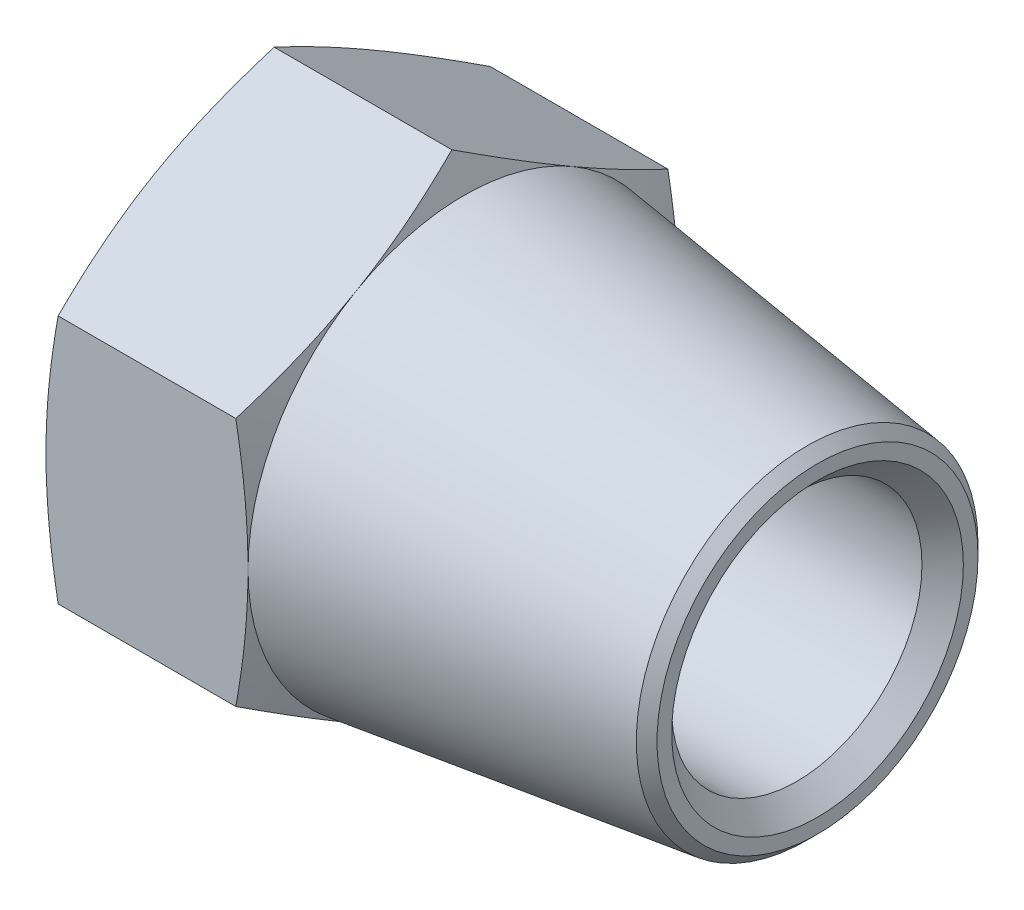
from build123d import *

# Parameters (mm, degrees)
SKETCH1_W          = 9.525
SKETCH1_H          = 9.525
CUT_SWEEP1_PITCH   = 1.5875
EXTRUDE1_DEPTH     = 10.390909091
SKETCH10_OUTSIDE_W = 146.182
SKETCH10_OUTSIDE_H = 149.622
SKETCH10_OUTSIDE_R = 11.1125
CUT_EXTRUDE2_DEPTH = 20.902483672
CUT_EXTRUDE2_DRAFT = -70
SKETCH11_OUTSIDE_W = 146.182
SKETCH11_OUTSIDE_H = 149.622
SKETCH11_OUTSIDE_R = 11.1125
CUT_EXTRUDE3_DEPTH = 20.902483724
CUT_EXTRUDE3_DRAFT = -70


with BuildPart() as part:
    # Sketch1 → Revolve1 (revolve)
    with BuildSketch(Plane.XY, mode=Mode.PRIVATE) as revolve1_sk:
        with Locations((4.7625, 4.7625)):
            Rectangle(SKETCH1_W, SKETCH1_H)
    revolve(revolve1_sk.sketch.rotate(Axis((0, 0, 0), (-1, 0, 0)), 90), axis=Axis((0, 0, 0), (-1, 0, 0)))

    # Cut-Sweep1: the profile of Sketch13 profile screwed along a right-hand helix of 7 turns, 8 arcs to a turn; built about Z, then put on its axis
    cut_sweep1_z = Axis((0, 0, 0), (0, 0, 1))
    cut_sweep1_corners = [(9.5253, 0, -1.389235705), (9.5253, 0, 0.000173205), (8.493888504, 0, -0.5953125), (8.493888504, 0, -0.79375)]
    with BuildLine(mode=Mode.PRIVATE) as cut_sweep1_profile:
        Line(cut_sweep1_corners[0], cut_sweep1_corners[1])
        Line(cut_sweep1_corners[1], cut_sweep1_corners[2])
        Line(cut_sweep1_corners[2], cut_sweep1_corners[3])
        Line(cut_sweep1_corners[3], cut_sweep1_corners[0])
    cut_sweep1_cap = Face(cut_sweep1_profile.wire())
    cut_sweep1_turn_angles = [0, 22.5, 45, 67.5, 90, 112.5, 135, 157.5, 180, 202.5, 225, 247.5, 270, 292.5, 315, 337.5, 360]
    cut_sweep1_turn_weights = [1, 0.9238795325112867, 1, 0.9238795325112867, 1, 0.9238795325112867, 1, 0.9238795325112867, 1, 0.9238795325112867, 1, 0.9238795325112867, 1, 0.9238795325112867, 1, 0.9238795325112867, 1]
    cut_sweep1_turn_rails = [Edge.make_bspline([Vector(p[0], p[1], 0).rotate(cut_sweep1_z, cut_sweep1_turn_angles[k]) / cut_sweep1_turn_weights[k] + Vector(0, 0, p[2] + CUT_SWEEP1_PITCH * cut_sweep1_turn_angles[k] / 360) for k in range(17)], [0, 0, 0, 1, 1, 2, 2, 3, 3, 4, 4, 5, 5, 6, 6, 7, 7, 8, 8, 8], 2, cut_sweep1_turn_weights) for p in cut_sweep1_corners]
    cut_sweep1_turn_sides = [Face.make_surface_from_curves(cut_sweep1_turn_rails[p[0]], cut_sweep1_turn_rails[p[1]]) for p in [(0, 1), (1, 2), (2, 3), (3, 0)]]
    cut_sweep1 = Plane(origin=(0, 0, 0), x_dir=(0, 1, 0), z_dir=(1, 0, 0)) * Solid(Shell([*[p.moved(Location((0, 0, CUT_SWEEP1_PITCH * i))) for i in range(7) for p in cut_sweep1_turn_sides], cut_sweep1_cap, cut_sweep1_cap.rotate(cut_sweep1_z, 2520).moved(Location((0, 0, CUT_SWEEP1_PITCH * 2520 / 360)))]))
    add(cut_sweep1, mode=Mode.SUBTRACT)


with BuildPart() as body_2:
    # Sketch4 → Extrude1 (new body)
    with BuildSketch(Plane.ZY):
        Polygon((0, 12.831609733), (-11.1125, 6.415804866), (-11.1125, -6.415804866), (0, -12.831609733), (11.1125, -6.415804866), (11.1125, 6.415804866), align=None)
    extrude(amount=-EXTRUDE1_DEPTH)

    # Combine1: cut part
    add(part.part, mode=Mode.SUBTRACT)

    # Cut-Extrude1 cone 1 section (through the dimple's axis) → Cut-Extrude1 (revolve, cut)
    with BuildSketch(Plane.ZX):
        Polygon((0, 0), (9.525, 0), (0, 9.525), align=None)
    revolve(axis=Axis((0, 0, 0), (1, 0, 0)), mode=Mode.SUBTRACT)


with BuildPart() as cut_extrude2_tool:
    # Sketch10 outside → Cut-Extrude2 (with draft: the straight prism first)
    with BuildSketch(Plane.ZY):
        Rectangle(SKETCH10_OUTSIDE_W, SKETCH10_OUTSIDE_H)
        Circle(SKETCH10_OUTSIDE_R, mode=Mode.SUBTRACT)
    extrude(amount=-CUT_EXTRUDE2_DEPTH)
    # Cut-Extrude2: the draft: its side faces are tilted about the plane it starts from
    cut_extrude2_sides = [cut_extrude2_tool.faces().sort_by_distance(p)[0] for p in [
        (10.451241836, -74.811, 0),
        (10.451241836, 0, 73.091),
        (10.451241836, 74.811, 0),
        (10.451241836, 0, -73.091),
        (10.451241836, 0, -11.1125),
    ]]
    draft(cut_extrude2_sides, Plane.ZY, CUT_EXTRUDE2_DRAFT)


with BuildPart() as body_2_1:
    add(body_2.part)

    # Cut-Extrude2: cut by cut_extrude2_tool
    add(cut_extrude2_tool.part, mode=Mode.SUBTRACT)


with BuildPart() as cut_extrude3_tool:
    # Sketch11 outside → Cut-Extrude3 (with draft: the straight prism first)
    with BuildSketch(Plane(origin=(10.390909091, 0, 0), x_dir=(0, 0, -1), z_dir=(1, 0, 0))):
        Rectangle(SKETCH11_OUTSIDE_W, SKETCH11_OUTSIDE_H)
        Circle(SKETCH11_OUTSIDE_R, mode=Mode.SUBTRACT)
    extrude(amount=-CUT_EXTRUDE3_DEPTH)
    # Cut-Extrude3: the draft: its side faces are tilted about the plane it starts from
    cut_extrude3_sides = [cut_extrude3_tool.faces().sort_by_distance(p)[0] for p in [
        (-0.060332771, -74.811, 0),
        (-0.060332771, 0, -73.091),
        (-0.060332771, 74.811, 0),
        (-0.060332771, 0, 73.091),
        (-0.060332771, 0, 11.1125),
    ]]
    draft(cut_extrude3_sides, Plane(origin=(10.390909091, 0, 0), x_dir=(0, 0, -1), z_dir=(1, 0, 0)), CUT_EXTRUDE3_DRAFT)


with BuildPart() as body_2_2:
    add(body_2_1.part)

    # Cut-Extrude3: cut by cut_extrude3_tool
    add(cut_extrude3_tool.part, mode=Mode.SUBTRACT)

    # Sketch5 → Revolve2 (revolve)
    with BuildSketch(Plane.XY, mode=Mode.PRIVATE) as revolve2_sk:
        Polygon((10.390909091, 11.1125), (10.390909091, 6.4389), (27.510394508, 6.4389), (28.575, 7.503505492), (28.575, 8.256295255), (28.042697254, 8.788598001), align=None)
    revolve(revolve2_sk.sketch.rotate(Axis((28.575, 0, 0), (-1, 0, 0)), 90), axis=Axis((28.575, 0, 0), (-1, 0, 0)))

    # Sketch7 → Cut-Revolve3 (revolve, cut)
    with BuildSketch(Plane.XY, mode=Mode.PRIVATE) as cut_revolve3_sk:
        Polygon((19.05, 0), (9.525, 9.525), (9.525, 0), align=None)
    revolve(cut_revolve3_sk.sketch.rotate(Axis((0, 0, 0), (1, 0, 0)), 270), axis=Axis((0, 0, 0), (1, 0, 0)), mode=Mode.SUBTRACT)


solid = body_2_2.part
